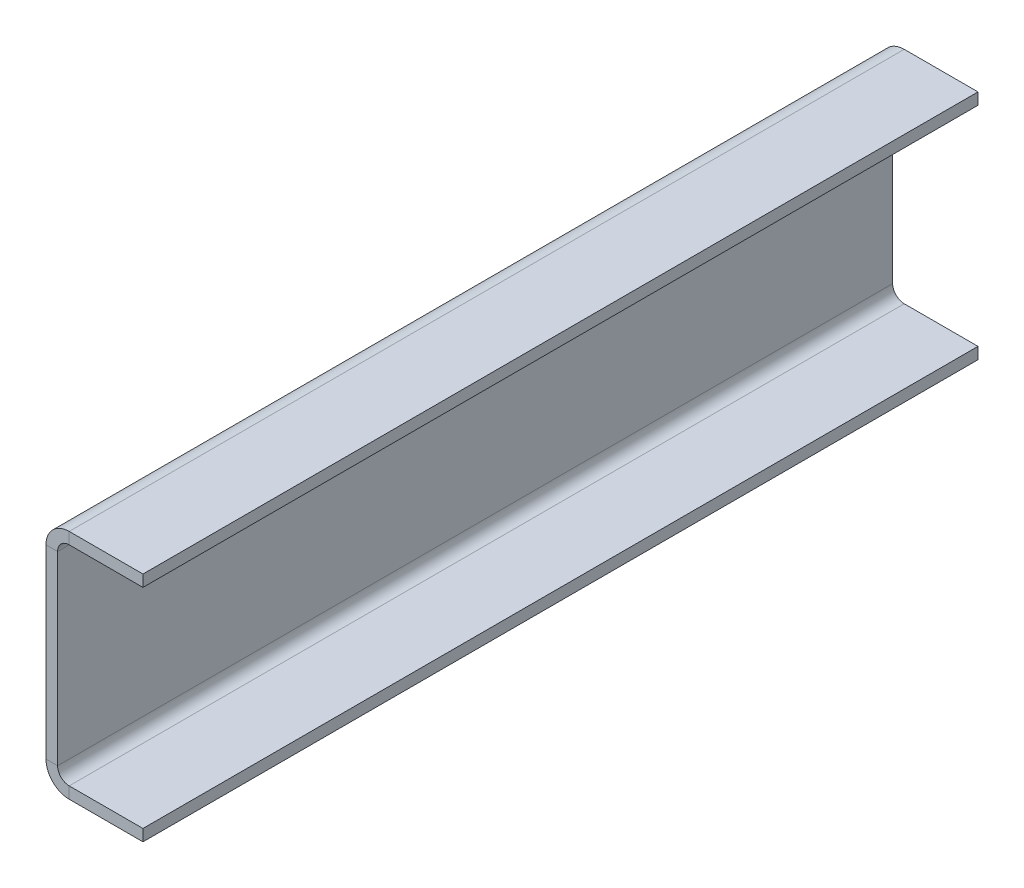
from build123d import *

# Parameters (mm, degrees)
SKETCH1_W                      = 228.6
SKETCH1_H                      = 63.5
BASE_FLANGE1_DEPTH             = 3.175
EDGE_FLANGE1_STRIP_W           = 19.05
EDGE_FLANGE1_STRIP_H           = 3.175
EDGE_FLANGE1_STRIP_CUT_DEPTH   = 228.6
EDGE_FLANGE1_STRIP_2_W         = 19.05
EDGE_FLANGE1_STRIP_2_H         = 3.175
EDGE_FLANGE1_STRIP_CUT_2_DEPTH = 228.6
EDGE_FLANGE1_DEPTH             = 228.6
EDGE_FLANGE1_BEND_DEPTH        = 228.6


# Sheet-metal steps are written as plain solids
with BuildPart() as part:
    # Sketch1 → Base-Flange1 (new body)
    with BuildSketch(Plane(origin=(0, 0, 0), x_dir=(0, 0, -1), z_dir=(1, 0, 0))):
        with Locations((114.3, 31.75)):
            Rectangle(SKETCH1_W, SKETCH1_H)
    extrude(amount=-BASE_FLANGE1_DEPTH)

    # Edge-Flange1 strip (across the edge) → Edge-Flange1 strip cut (cut)
    with BuildSketch(Plane(origin=(0, 63.5, -228.6), x_dir=(0, -1, 0), z_dir=(0, 0, 1))):
        with Locations((-3.175, -1.5875)):
            Rectangle(EDGE_FLANGE1_STRIP_W, EDGE_FLANGE1_STRIP_H)
    extrude(amount=EDGE_FLANGE1_STRIP_CUT_DEPTH, mode=Mode.SUBTRACT)

    # Edge-Flange1 strip 2 (across the edge) → Edge-Flange1 strip cut 2 (cut)
    with BuildSketch(Plane.YX):
        with Locations((-3.175, -1.5875)):
            Rectangle(EDGE_FLANGE1_STRIP_2_W, EDGE_FLANGE1_STRIP_2_H)
    extrude(amount=EDGE_FLANGE1_STRIP_CUT_2_DEPTH, mode=Mode.SUBTRACT)

    # Edge-Flange1 section (across the edge) → Edge-Flange1 (add)
    with BuildSketch(Plane(origin=(0, 63.5, -228.6), x_dir=(0, -1, 0), z_dir=(0, 0, 1))):
        with BuildLine():
            Line((0, 3.175), (0, 23.368))
            Line((0, 23.368), (3.175, 23.368))
            Line((3.175, 23.368), (3.175, 3.175))
            ThreePointArc((3.175, 3.175), (4.10493597, 0.92993597), (6.35, 0))
            Line((6.35, 0), (6.35, -3.175))
            ThreePointArc((6.35, -3.175), (1.859871939, -1.315128061), (0, 3.175))
        make_face()
    extrude(amount=EDGE_FLANGE1_DEPTH)

    # Edge-Flange1 section 2 (across the edge) → Edge-Flange1 bend (add)
    with BuildSketch(Plane.YX):
        with BuildLine():
            Line((0, 3.175), (0, 23.368))
            Line((0, 23.368), (3.175, 23.368))
            Line((3.175, 23.368), (3.175, 3.175))
            ThreePointArc((3.175, 3.175), (4.10493597, 0.92993597), (6.35, 0))
            Line((6.35, 0), (6.35, -3.175))
            ThreePointArc((6.35, -3.175), (1.859871939, -1.315128061), (0, 3.175))
        make_face()
    extrude(amount=EDGE_FLANGE1_BEND_DEPTH)


solid = part.part
